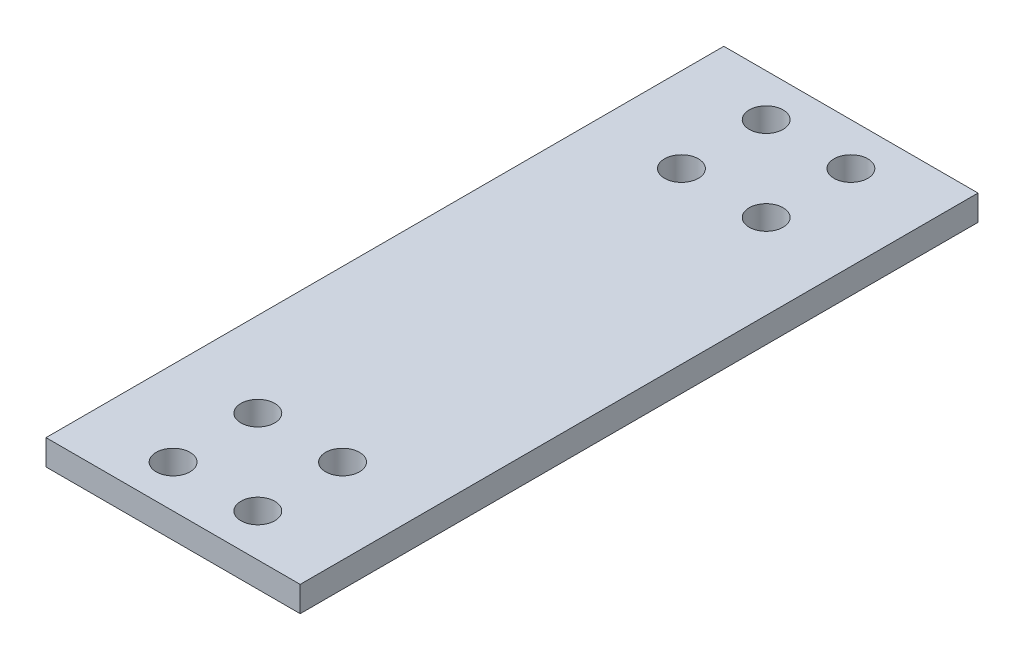
from build123d import *

# Parameters (mm, degrees)
SKETCH2_W           = 15
SKETCH2_H           = 40
SKETCH2_R           = 2
BOSS_EXTRUDE1_DEPTH = 3
MIRROR1_OUTLINE_R   = 2
MIRROR1_DEPTH       = 3


# Read off the part's stored shape, not the designer's step: Mirror1
with BuildPart() as part:
    # Sketch2 → Boss-Extrude1 (new body)
    with BuildSketch(Plane(origin=(0, 0, 0), x_dir=(1, 0, 0), z_dir=(0, 1, 0))):
        with Locations((-7.5, 20)):
            Rectangle(SKETCH2_W, SKETCH2_H)
        with Locations(Location((-5, 35, 0), (0, 0, 270))):
            Circle(SKETCH2_R, mode=Mode.SUBTRACT)
        with Locations(Location((-5, 25, 0), (0, 0, 270))):
            Circle(SKETCH2_R, mode=Mode.SUBTRACT)
    extrude(amount=BOSS_EXTRUDE1_DEPTH)

    # Mirror1 outline → Mirror1 (add)
    with BuildSketch(Plane(origin=(0, 0, 0), x_dir=(1, 0, 0), z_dir=(0, 1, 0))):
        Polygon((15, 40), (0, 40), (0, 0), (-15, 0), (-15, -40), (15, -40), align=None)
        with Locations((-5, -35)):
            Circle(MIRROR1_OUTLINE_R, mode=Mode.SUBTRACT)
        with Locations((-5, -25)):
            Circle(MIRROR1_OUTLINE_R, mode=Mode.SUBTRACT)
        with Locations((5, -35)):
            Circle(MIRROR1_OUTLINE_R, mode=Mode.SUBTRACT)
        with Locations((5, -25)):
            Circle(MIRROR1_OUTLINE_R, mode=Mode.SUBTRACT)
        with Locations((5, 25)):
            Circle(MIRROR1_OUTLINE_R, mode=Mode.SUBTRACT)
        with Locations((5, 35)):
            Circle(MIRROR1_OUTLINE_R, mode=Mode.SUBTRACT)
    extrude(amount=MIRROR1_DEPTH)


solid = part.part
